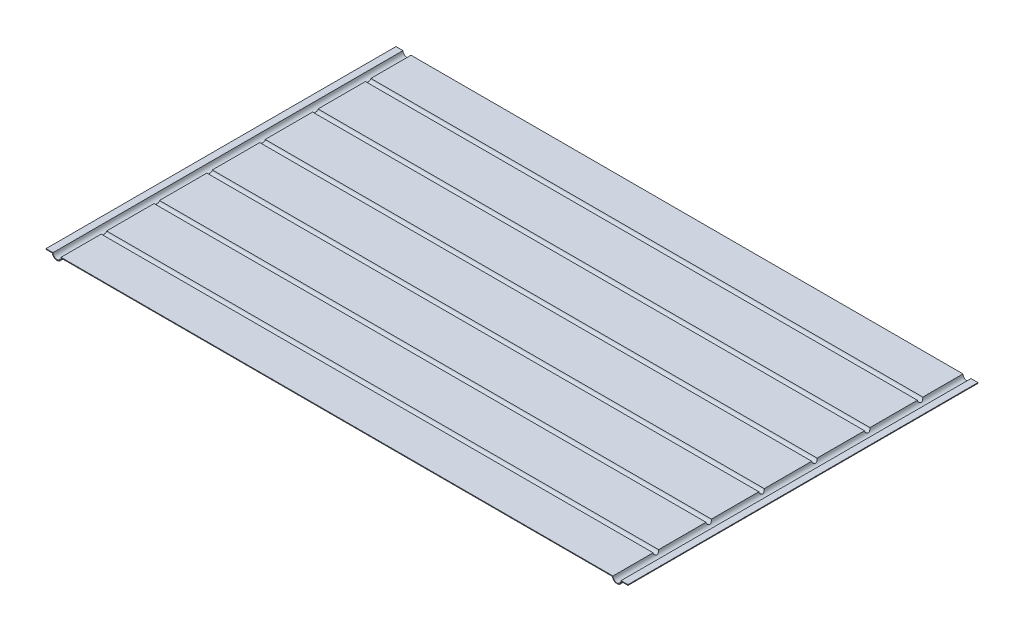
from build123d import *

# Parameters (mm, degrees)
BOSS_EXTRUDE1_DEPTH                  = 1000
SKETCH2_R                            = 7.75
CUT_EXTRUDE1_DEPTH                   = 1941.468322983
BOSS_EXTRUDE2_REACH                  = 1302.573
BOSS_EXTRUDE2_END_RADIUS             = 13.45
BOSS_EXTRUDE2_DIRECTION_2_REACH      = 1302.573
BOSS_EXTRUDE2_DIRECTION_2_END_RADIUS = 13.45
BOSS_EXTRUDE4_REACH                  = 1942.468
BOSS_EXTRUDE4_END_RADIUS             = 11.45
CUT_EXTRUDE2_DEPTH                   = 1914.585641023
BOSS_EXTRUDE5_REACH                  = 1942.468
BOSS_EXTRUDE5_END_RADIUS             = 11.45
CUT_EXTRUDE3_DEPTH                   = 1914.585640938


with BuildPart() as part:
    # Sketch1 → Boss-Extrude1 (new body)
    with BuildSketch(Plane.XY):
        with BuildLine():
            Line((11.45, 0), (1587.55, 0))
            Line((1587.55, 0), (1588.55, 0))
            ThreePointArc((1588.55, 0), (1600, -11.45), (1611.45, 0))
            Line((1611.45, 0), (1613.45, 0))
            Line((1613.45, 0), (1631.45, 0))
            Line((1631.45, 0), (1631.45, -2))
            Line((1631.45, -2), (1613.45, -2))
            Line((1613.45, -2), (1613.300469917, -2))
            ThreePointArc((1613.300469917, -2), (1600, -13.45), (1586.699530083, -2))
            Line((1586.699530083, -2), (13.300469917, -2))
            ThreePointArc((13.300469917, -2), (0, -13.45), (-13.300469917, -2))
            Line((-13.300469917, -2), (-31.45, -2))
            Line((-31.45, -2), (-31.45, 0))
            Line((-31.45, 0), (-12.45, 0))
            Line((-12.45, 0), (-11.45, 0))
            ThreePointArc((-11.45, 0), (0, -11.45), (11.45, 0))
        make_face()
    extrude(amount=BOSS_EXTRUDE1_DEPTH)

    # Sketch2 → Cut-Extrude1 (cut, through all)
    with BuildSketch(Plane.ZY.offset(31.45)):
        with Locations((122.5, 0)):
            Circle(SKETCH2_R)
        with Locations((273.5, 0)):
            Circle(SKETCH2_R)
        with Locations((424.5, 0)):
            Circle(SKETCH2_R)
        with Locations((575.5, 0)):
            Circle(SKETCH2_R)
        with Locations((726.5, 0)):
            Circle(SKETCH2_R)
        with Locations((877.5, 0)):
            Circle(SKETCH2_R)
    extrude(amount=-CUT_EXTRUDE1_DEPTH, mode=Mode.SUBTRACT)

    # Boss-Extrude2: up to this cylinder (the profile starts outside it)
    boss_extrude2_end = Plane(origin=(1600, 0, 495.625), z_dir=(0, 0, -1)) * Cylinder(BOSS_EXTRUDE2_END_RADIUS, 3379.296, mode=Mode.PRIVATE)
    # Sketch5 → Boss-Extrude2 (add, up to the surface)
    with BuildSketch(Plane(origin=(800, 0, 0), x_dir=(0, 0, -1), z_dir=(1, 0, 0)), mode=Mode.PRIVATE) as boss_extrude2_sk1:
        with BuildLine():
            Line((-887.25, 0), (-885.25, 0))
            ThreePointArc((-885.25, 0), (-877.5, -7.75), (-869.75, 0))
            Line((-869.75, 0), (-867.75, 0))
            ThreePointArc((-867.75, 0), (-877.5, -9.75), (-887.25, 0))
        make_face()
    boss_extrude2_tool1 = extrude(boss_extrude2_sk1.sketch, amount=BOSS_EXTRUDE2_REACH, mode=Mode.PRIVATE) - boss_extrude2_end
    add(boss_extrude2_tool1.solids().sort_by_distance((800, -0.218017, 868.75))[0])
    # Sketch5 → Boss-Extrude2 (add, up to the surface)
    with BuildSketch(Plane(origin=(800, 0, 0), x_dir=(0, 0, -1), z_dir=(1, 0, 0)), mode=Mode.PRIVATE) as boss_extrude2_sk2:
        with BuildLine():
            Line((-718.75, 0), (-716.75, 0))
            ThreePointArc((-716.75, 0), (-726.5, -9.75), (-736.25, 0))
            Line((-736.25, 0), (-734.25, 0))
            ThreePointArc((-734.25, 0), (-726.5, -7.75), (-718.75, 0))
        make_face()
    boss_extrude2_tool2 = extrude(boss_extrude2_sk2.sketch, amount=BOSS_EXTRUDE2_REACH, mode=Mode.PRIVATE) - boss_extrude2_end
    add(boss_extrude2_tool2.solids().sort_by_distance((800, -0.218017, 735.25))[0])
    # Sketch5 → Boss-Extrude2 (add, up to the surface)
    with BuildSketch(Plane(origin=(800, 0, 0), x_dir=(0, 0, -1), z_dir=(1, 0, 0)), mode=Mode.PRIVATE) as boss_extrude2_sk3:
        with BuildLine():
            Line((-567.75, 0), (-565.75, 0))
            ThreePointArc((-565.75, 0), (-575.5, -9.75), (-585.25, 0))
            Line((-585.25, 0), (-583.25, 0))
            ThreePointArc((-583.25, 0), (-575.5, -7.75), (-567.75, 0))
        make_face()
    boss_extrude2_tool3 = extrude(boss_extrude2_sk3.sketch, amount=BOSS_EXTRUDE2_REACH, mode=Mode.PRIVATE) - boss_extrude2_end
    add(boss_extrude2_tool3.solids().sort_by_distance((800, -0.218017, 566.75))[0])
    # Sketch5 → Boss-Extrude2 (add, up to the surface)
    with BuildSketch(Plane(origin=(800, 0, 0), x_dir=(0, 0, -1), z_dir=(1, 0, 0)), mode=Mode.PRIVATE) as boss_extrude2_sk4:
        with BuildLine():
            Line((-416.75, 0), (-414.75, 0))
            ThreePointArc((-414.75, 0), (-424.5, -9.75), (-434.25, 0))
            Line((-434.25, 0), (-432.25, 0))
            ThreePointArc((-432.25, 0), (-424.5, -7.75), (-416.75, 0))
        make_face()
    boss_extrude2_tool4 = extrude(boss_extrude2_sk4.sketch, amount=BOSS_EXTRUDE2_REACH, mode=Mode.PRIVATE) - boss_extrude2_end
    add(boss_extrude2_tool4.solids().sort_by_distance((800, -0.218017, 415.75))[0])
    # Sketch5 → Boss-Extrude2 (add, up to the surface)
    with BuildSketch(Plane(origin=(800, 0, 0), x_dir=(0, 0, -1), z_dir=(1, 0, 0)), mode=Mode.PRIVATE) as boss_extrude2_sk5:
        with BuildLine():
            Line((-265.75, 0), (-263.75, 0))
            ThreePointArc((-263.75, 0), (-273.5, -9.75), (-283.25, 0))
            Line((-283.25, 0), (-281.25, 0))
            ThreePointArc((-281.25, 0), (-273.5, -7.75), (-265.75, 0))
        make_face()
    boss_extrude2_tool5 = extrude(boss_extrude2_sk5.sketch, amount=BOSS_EXTRUDE2_REACH, mode=Mode.PRIVATE) - boss_extrude2_end
    add(boss_extrude2_tool5.solids().sort_by_distance((800, -0.218017, 282.25))[0])
    # Sketch5 → Boss-Extrude2 (add, up to the surface)
    with BuildSketch(Plane(origin=(800, 0, 0), x_dir=(0, 0, -1), z_dir=(1, 0, 0)), mode=Mode.PRIVATE) as boss_extrude2_sk6:
        with BuildLine():
            Line((-114.75, 0), (-112.75, 0))
            ThreePointArc((-112.75, 0), (-122.5, -9.75), (-132.25, 0))
            Line((-132.25, 0), (-130.25, 0))
            ThreePointArc((-130.25, 0), (-122.5, -7.75), (-114.75, 0))
        make_face()
    boss_extrude2_tool6 = extrude(boss_extrude2_sk6.sketch, amount=BOSS_EXTRUDE2_REACH, mode=Mode.PRIVATE) - boss_extrude2_end
    add(boss_extrude2_tool6.solids().sort_by_distance((800, -9.531983, 122.5))[0])

    # Boss-Extrude2 direction 2: up to this cylinder (the profile starts outside it)
    boss_extrude2_direction_2_end = Plane(origin=(0, 0, 495.625), z_dir=(0, 0, -1)) * Cylinder(BOSS_EXTRUDE2_DIRECTION_2_END_RADIUS, 3379.296, mode=Mode.PRIVATE)
    # Sketch5 → Boss-Extrude2 direction 2 (add, up to the surface)
    with BuildSketch(Plane(origin=(800, 0, 0), x_dir=(0, 0, -1), z_dir=(1, 0, 0)), mode=Mode.PRIVATE) as boss_extrude2_direction_2_sk1:
        with BuildLine():
            Line((-887.25, 0), (-885.25, 0))
            ThreePointArc((-885.25, 0), (-877.5, -7.75), (-869.75, 0))
            Line((-869.75, 0), (-867.75, 0))
            ThreePointArc((-867.75, 0), (-877.5, -9.75), (-887.25, 0))
        make_face()
    boss_extrude2_direction_2_tool1 = extrude(boss_extrude2_direction_2_sk1.sketch, amount=-BOSS_EXTRUDE2_DIRECTION_2_REACH, mode=Mode.PRIVATE) - boss_extrude2_direction_2_end
    add(boss_extrude2_direction_2_tool1.solids().sort_by_distance((800, -0.218017, 868.75))[0])
    # Sketch5 → Boss-Extrude2 direction 2 (add, up to the surface)
    with BuildSketch(Plane(origin=(800, 0, 0), x_dir=(0, 0, -1), z_dir=(1, 0, 0)), mode=Mode.PRIVATE) as boss_extrude2_direction_2_sk2:
        with BuildLine():
            Line((-718.75, 0), (-716.75, 0))
            ThreePointArc((-716.75, 0), (-726.5, -9.75), (-736.25, 0))
            Line((-736.25, 0), (-734.25, 0))
            ThreePointArc((-734.25, 0), (-726.5, -7.75), (-718.75, 0))
        make_face()
    boss_extrude2_direction_2_tool2 = extrude(boss_extrude2_direction_2_sk2.sketch, amount=-BOSS_EXTRUDE2_DIRECTION_2_REACH, mode=Mode.PRIVATE) - boss_extrude2_direction_2_end
    add(boss_extrude2_direction_2_tool2.solids().sort_by_distance((800, -0.218017, 735.25))[0])
    # Sketch5 → Boss-Extrude2 direction 2 (add, up to the surface)
    with BuildSketch(Plane(origin=(800, 0, 0), x_dir=(0, 0, -1), z_dir=(1, 0, 0)), mode=Mode.PRIVATE) as boss_extrude2_direction_2_sk3:
        with BuildLine():
            Line((-567.75, 0), (-565.75, 0))
            ThreePointArc((-565.75, 0), (-575.5, -9.75), (-585.25, 0))
            Line((-585.25, 0), (-583.25, 0))
            ThreePointArc((-583.25, 0), (-575.5, -7.75), (-567.75, 0))
        make_face()
    boss_extrude2_direction_2_tool3 = extrude(boss_extrude2_direction_2_sk3.sketch, amount=-BOSS_EXTRUDE2_DIRECTION_2_REACH, mode=Mode.PRIVATE) - boss_extrude2_direction_2_end
    add(boss_extrude2_direction_2_tool3.solids().sort_by_distance((800, -0.218017, 566.75))[0])
    # Sketch5 → Boss-Extrude2 direction 2 (add, up to the surface)
    with BuildSketch(Plane(origin=(800, 0, 0), x_dir=(0, 0, -1), z_dir=(1, 0, 0)), mode=Mode.PRIVATE) as boss_extrude2_direction_2_sk4:
        with BuildLine():
            Line((-416.75, 0), (-414.75, 0))
            ThreePointArc((-414.75, 0), (-424.5, -9.75), (-434.25, 0))
            Line((-434.25, 0), (-432.25, 0))
            ThreePointArc((-432.25, 0), (-424.5, -7.75), (-416.75, 0))
        make_face()
    boss_extrude2_direction_2_tool4 = extrude(boss_extrude2_direction_2_sk4.sketch, amount=-BOSS_EXTRUDE2_DIRECTION_2_REACH, mode=Mode.PRIVATE) - boss_extrude2_direction_2_end
    add(boss_extrude2_direction_2_tool4.solids().sort_by_distance((800, -0.218017, 415.75))[0])
    # Sketch5 → Boss-Extrude2 direction 2 (add, up to the surface)
    with BuildSketch(Plane(origin=(800, 0, 0), x_dir=(0, 0, -1), z_dir=(1, 0, 0)), mode=Mode.PRIVATE) as boss_extrude2_direction_2_sk5:
        with BuildLine():
            Line((-265.75, 0), (-263.75, 0))
            ThreePointArc((-263.75, 0), (-273.5, -9.75), (-283.25, 0))
            Line((-283.25, 0), (-281.25, 0))
            ThreePointArc((-281.25, 0), (-273.5, -7.75), (-265.75, 0))
        make_face()
    boss_extrude2_direction_2_tool5 = extrude(boss_extrude2_direction_2_sk5.sketch, amount=-BOSS_EXTRUDE2_DIRECTION_2_REACH, mode=Mode.PRIVATE) - boss_extrude2_direction_2_end
    add(boss_extrude2_direction_2_tool5.solids().sort_by_distance((800, -0.218017, 282.25))[0])
    # Sketch5 → Boss-Extrude2 direction 2 (add, up to the surface)
    with BuildSketch(Plane(origin=(800, 0, 0), x_dir=(0, 0, -1), z_dir=(1, 0, 0)), mode=Mode.PRIVATE) as boss_extrude2_direction_2_sk6:
        with BuildLine():
            Line((-114.75, 0), (-112.75, 0))
            ThreePointArc((-112.75, 0), (-122.5, -9.75), (-132.25, 0))
            Line((-132.25, 0), (-130.25, 0))
            ThreePointArc((-130.25, 0), (-122.5, -7.75), (-114.75, 0))
        make_face()
    boss_extrude2_direction_2_tool6 = extrude(boss_extrude2_direction_2_sk6.sketch, amount=-BOSS_EXTRUDE2_DIRECTION_2_REACH, mode=Mode.PRIVATE) - boss_extrude2_direction_2_end
    add(boss_extrude2_direction_2_tool6.solids().sort_by_distance((800, -9.531983, 122.5))[0])

    # Boss-Extrude4: up to this cylinder (the profile starts outside it)
    boss_extrude4_end = Plane(origin=(1600, 0, 500), z_dir=(0, 0, -1)) * Cylinder(BOSS_EXTRUDE4_END_RADIUS, 4663.836, mode=Mode.PRIVATE)
    # Sketch6 → Boss-Extrude4 (add, up to the surface)
    with BuildSketch(Plane(origin=(1631.45, 0, 0), x_dir=(0, 0, -1), z_dir=(1, 0, 0)), mode=Mode.PRIVATE) as boss_extrude4_sk1:
        with BuildLine():
            Line((-130.25, 0), (-114.75, 0))
            ThreePointArc((-114.75, 0), (-122.5, -7.75), (-130.25, 0))
        make_face()
    boss_extrude4_tool1 = extrude(boss_extrude4_sk1.sketch, amount=-BOSS_EXTRUDE4_REACH, mode=Mode.PRIVATE) - boss_extrude4_end
    add(boss_extrude4_tool1.solids().sort_by_distance((1631.45, -3.289202, 122.5))[0])
    # Sketch6 → Boss-Extrude4 (add, up to the surface)
    with BuildSketch(Plane(origin=(1631.45, 0, 0), x_dir=(0, 0, -1), z_dir=(1, 0, 0)), mode=Mode.PRIVATE) as boss_extrude4_sk2:
        with BuildLine():
            Line((-281.25, 0), (-265.75, 0))
            ThreePointArc((-265.75, 0), (-273.5, -7.75), (-281.25, 0))
        make_face()
    boss_extrude4_tool2 = extrude(boss_extrude4_sk2.sketch, amount=-BOSS_EXTRUDE4_REACH, mode=Mode.PRIVATE) - boss_extrude4_end
    add(boss_extrude4_tool2.solids().sort_by_distance((1631.45, -3.289202, 273.5))[0])
    # Sketch6 → Boss-Extrude4 (add, up to the surface)
    with BuildSketch(Plane(origin=(1631.45, 0, 0), x_dir=(0, 0, -1), z_dir=(1, 0, 0)), mode=Mode.PRIVATE) as boss_extrude4_sk3:
        with BuildLine():
            Line((-432.25, 0), (-416.75, 0))
            ThreePointArc((-416.75, 0), (-424.5, -7.75), (-432.25, 0))
        make_face()
    boss_extrude4_tool3 = extrude(boss_extrude4_sk3.sketch, amount=-BOSS_EXTRUDE4_REACH, mode=Mode.PRIVATE) - boss_extrude4_end
    add(boss_extrude4_tool3.solids().sort_by_distance((1631.45, -3.289202, 424.5))[0])
    # Sketch6 → Boss-Extrude4 (add, up to the surface)
    with BuildSketch(Plane(origin=(1631.45, 0, 0), x_dir=(0, 0, -1), z_dir=(1, 0, 0)), mode=Mode.PRIVATE) as boss_extrude4_sk4:
        with BuildLine():
            Line((-583.25, 0), (-567.75, 0))
            ThreePointArc((-567.75, 0), (-575.5, -7.75), (-583.25, 0))
        make_face()
    boss_extrude4_tool4 = extrude(boss_extrude4_sk4.sketch, amount=-BOSS_EXTRUDE4_REACH, mode=Mode.PRIVATE) - boss_extrude4_end
    add(boss_extrude4_tool4.solids().sort_by_distance((1631.45, -3.289202, 575.5))[0])
    # Sketch6 → Boss-Extrude4 (add, up to the surface)
    with BuildSketch(Plane(origin=(1631.45, 0, 0), x_dir=(0, 0, -1), z_dir=(1, 0, 0)), mode=Mode.PRIVATE) as boss_extrude4_sk5:
        with BuildLine():
            Line((-734.25, 0), (-718.75, 0))
            ThreePointArc((-718.75, 0), (-726.5, -7.75), (-734.25, 0))
        make_face()
    boss_extrude4_tool5 = extrude(boss_extrude4_sk5.sketch, amount=-BOSS_EXTRUDE4_REACH, mode=Mode.PRIVATE) - boss_extrude4_end
    add(boss_extrude4_tool5.solids().sort_by_distance((1631.45, -3.289202, 726.5))[0])
    # Sketch6 → Boss-Extrude4 (add, up to the surface)
    with BuildSketch(Plane(origin=(1631.45, 0, 0), x_dir=(0, 0, -1), z_dir=(1, 0, 0)), mode=Mode.PRIVATE) as boss_extrude4_sk6:
        with BuildLine():
            Line((-885.25, 0), (-869.75, 0))
            ThreePointArc((-869.75, 0), (-877.5, -7.75), (-885.25, 0))
        make_face()
    boss_extrude4_tool6 = extrude(boss_extrude4_sk6.sketch, amount=-BOSS_EXTRUDE4_REACH, mode=Mode.PRIVATE) - boss_extrude4_end
    add(boss_extrude4_tool6.solids().sort_by_distance((1631.45, -3.289202, 877.5))[0])

    # Sketch7 → Cut-Extrude2 (cut, through all)
    with BuildSketch(Plane(origin=(0, 0, 0), x_dir=(-1, 0, 0), z_dir=(0, 0, -1))):
        with BuildLine():
            Line((-1613.300469917, -2), (-1631.45, -2))
            Line((-1631.45, -2), (-1631.45, -7.75))
            Line((-1631.45, -7.75), (-1610.992724867, -7.75))
            ThreePointArc((-1610.992724867, -7.75), (-1612.482205462, -5.009695281), (-1613.300469917, -2))
        make_face()
        with BuildLine():
            Line((13.300469917, -2), (31.45, -2))
            Line((31.45, -2), (31.45, -7.75))
            Line((31.45, -7.75), (10.992724867, -7.75))
            ThreePointArc((10.992724867, -7.75), (12.482205462, -5.009695281), (13.300469917, -2))
        make_face()
    extrude(amount=-CUT_EXTRUDE2_DEPTH, mode=Mode.SUBTRACT)

    # Boss-Extrude5: up to this cylinder (the profile starts outside it)
    boss_extrude5_end = Plane(origin=(0, 0, 500), z_dir=(0, 0, -1)) * Cylinder(BOSS_EXTRUDE5_END_RADIUS, 4663.836, mode=Mode.PRIVATE)
    # Sketch8 → Boss-Extrude5 (add, up to the surface)
    with BuildSketch(Plane.ZY.offset(31.45), mode=Mode.PRIVATE) as boss_extrude5_sk1:
        with BuildLine():
            Line((130.25, 0), (114.75, 0))
            ThreePointArc((114.75, 0), (122.5, -7.75), (130.25, 0))
        make_face()
    boss_extrude5_tool1 = extrude(boss_extrude5_sk1.sketch, amount=-BOSS_EXTRUDE5_REACH, mode=Mode.PRIVATE) - boss_extrude5_end
    add(boss_extrude5_tool1.solids().sort_by_distance((-31.45, -3.289202, 122.5))[0])
    # Sketch8 → Boss-Extrude5 (add, up to the surface)
    with BuildSketch(Plane.ZY.offset(31.45), mode=Mode.PRIVATE) as boss_extrude5_sk2:
        with BuildLine():
            Line((281.25, 0), (265.75, 0))
            ThreePointArc((265.75, 0), (273.5, -7.75), (281.25, 0))
        make_face()
    boss_extrude5_tool2 = extrude(boss_extrude5_sk2.sketch, amount=-BOSS_EXTRUDE5_REACH, mode=Mode.PRIVATE) - boss_extrude5_end
    add(boss_extrude5_tool2.solids().sort_by_distance((-31.45, -3.289202, 273.5))[0])
    # Sketch8 → Boss-Extrude5 (add, up to the surface)
    with BuildSketch(Plane.ZY.offset(31.45), mode=Mode.PRIVATE) as boss_extrude5_sk3:
        with BuildLine():
            Line((432.25, 0), (416.75, 0))
            ThreePointArc((416.75, 0), (424.5, -7.75), (432.25, 0))
        make_face()
    boss_extrude5_tool3 = extrude(boss_extrude5_sk3.sketch, amount=-BOSS_EXTRUDE5_REACH, mode=Mode.PRIVATE) - boss_extrude5_end
    add(boss_extrude5_tool3.solids().sort_by_distance((-31.45, -3.289202, 424.5))[0])
    # Sketch8 → Boss-Extrude5 (add, up to the surface)
    with BuildSketch(Plane.ZY.offset(31.45), mode=Mode.PRIVATE) as boss_extrude5_sk4:
        with BuildLine():
            Line((583.25, 0), (567.75, 0))
            ThreePointArc((567.75, 0), (575.5, -7.75), (583.25, 0))
        make_face()
    boss_extrude5_tool4 = extrude(boss_extrude5_sk4.sketch, amount=-BOSS_EXTRUDE5_REACH, mode=Mode.PRIVATE) - boss_extrude5_end
    add(boss_extrude5_tool4.solids().sort_by_distance((-31.45, -3.289202, 575.5))[0])
    # Sketch8 → Boss-Extrude5 (add, up to the surface)
    with BuildSketch(Plane.ZY.offset(31.45), mode=Mode.PRIVATE) as boss_extrude5_sk5:
        with BuildLine():
            Line((734.25, 0), (718.75, 0))
            ThreePointArc((718.75, 0), (726.5, -7.75), (734.25, 0))
        make_face()
    boss_extrude5_tool5 = extrude(boss_extrude5_sk5.sketch, amount=-BOSS_EXTRUDE5_REACH, mode=Mode.PRIVATE) - boss_extrude5_end
    add(boss_extrude5_tool5.solids().sort_by_distance((-31.45, -3.289202, 726.5))[0])
    # Sketch8 → Boss-Extrude5 (add, up to the surface)
    with BuildSketch(Plane.ZY.offset(31.45), mode=Mode.PRIVATE) as boss_extrude5_sk6:
        with BuildLine():
            Line((885.25, 0), (869.75, 0))
            ThreePointArc((869.75, 0), (877.5, -7.75), (885.25, 0))
        make_face()
    boss_extrude5_tool6 = extrude(boss_extrude5_sk6.sketch, amount=-BOSS_EXTRUDE5_REACH, mode=Mode.PRIVATE) - boss_extrude5_end
    add(boss_extrude5_tool6.solids().sort_by_distance((-31.45, -3.289202, 877.5))[0])

    # Sketch7<2> → Cut-Extrude3 (cut, through all)
    with BuildSketch(Plane(origin=(0, 0, 0), x_dir=(-1, 0, 0), z_dir=(0, 0, -1))):
        with BuildLine():
            Line((-1613.300469917, -2), (-1631.45, -2))
            Line((-1631.45, -2), (-1631.45, -7.75))
            Line((-1631.45, -7.75), (-1610.992724867, -7.75))
            ThreePointArc((-1610.992724867, -7.75), (-1612.482205462, -5.009695281), (-1613.300469917, -2))
        make_face()
        with BuildLine():
            Line((13.300469917, -2), (31.45, -2))
            Line((31.45, -2), (31.45, -7.75))
            Line((31.45, -7.75), (10.992724867, -7.75))
            ThreePointArc((10.992724867, -7.75), (12.482205462, -5.009695281), (13.300469917, -2))
        make_face()
    extrude(amount=-CUT_EXTRUDE3_DEPTH, mode=Mode.SUBTRACT)


solid = part.part
